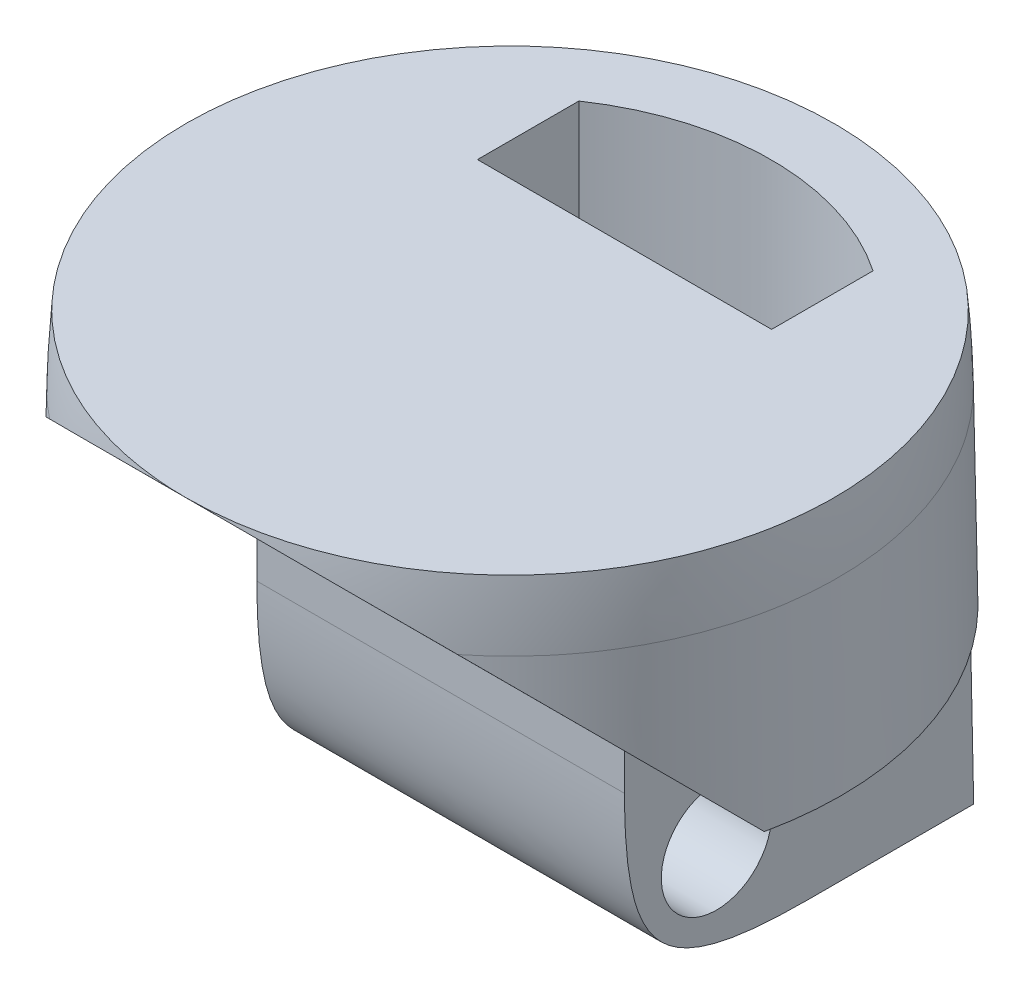
from build123d import *
from build123d.topology import SkipClean

# Parameters (mm, degrees)
SKETCH1_R                     = 9
BOSS_EXTRUDE1_DEPTH           = 15
BOSS_EXTRUDE1_TAPER           = 1
BOSS_EXTRUDE1_OTHER_WAY_DEPTH = 6
BOSS_EXTRUDE1_OTHER_WAY_TAPER = -1
CUT_EXTRUDE1_DEPTH            = 20.768465569
CUT_EXTRUDE1_DEPTH_BACK       = 20.768465569
SKETCH4_W                     = 6.502745185
SKETCH4_H                     = 6
CUT_EXTRUDE2_DEPTH            = 21.704916006
SKETCH5_R                     = 1.5
CUT_EXTRUDE3_DEPTH            = 23.447630679
FILLET1_SIZE                  = 5
CUT_EXTRUDE4_DEPTH            = 20.720449338
CUT_EXTRUDE4_DEPTH_BACK       = 20.720449338
SKETCH6_W                     = 20.06778765
SKETCH6_H                     = 8.725289236
CUT_EXTRUDE5_DEPTH            = 19.193852051


with BuildPart() as part:
    # Sketch1 → Boss-Extrude1 (new body)
    with BuildSketch(Plane(origin=(0, 0, 0), x_dir=(1, 0, 0), z_dir=(0, 1, 0))):
        Circle(SKETCH1_R)
    extrude(amount=BOSS_EXTRUDE1_DEPTH, taper=BOSS_EXTRUDE1_TAPER)

    # Sketch1 → Boss-Extrude1 other way (add)
    with BuildSketch(Plane(origin=(0, 0, 0), x_dir=(1, 0, 0), z_dir=(0, 1, 0))):
        Circle(SKETCH1_R)
    extrude(amount=-BOSS_EXTRUDE1_OTHER_WAY_DEPTH, taper=BOSS_EXTRUDE1_OTHER_WAY_TAPER)

    # Sketch3 → Cut-Extrude1 (cut, two sides: drawn at the far end of the back side and taken through both)
    with BuildSketch(Plane(origin=(0, 0, 0), x_dir=(0, 0, -1), z_dir=(1, 0, 0)).offset(-CUT_EXTRUDE1_DEPTH_BACK)):
        Polygon((-1.886057768, -6), (-1.886057768, 0), (-9.929766736, 8.043708969), (-9.929766736, -6), align=None)
    extrude(amount=CUT_EXTRUDE1_DEPTH + CUT_EXTRUDE1_DEPTH_BACK, mode=Mode.SUBTRACT)

    # Sketch4 → Cut-Extrude2 (cut, through all)
    with BuildSketch(Plane.XY.offset(1.886057768)):
        with Locations((-8.251372593, -3)):
            Rectangle(SKETCH4_W, SKETCH4_H)
        with Locations((8.251372593, -3)):
            Rectangle(SKETCH4_W, SKETCH4_H)
    extrude(amount=-CUT_EXTRUDE2_DEPTH, mode=Mode.SUBTRACT)

    # Sketch5 → Cut-Extrude3 (cut, through all)
    with BuildSketch(Plane(origin=(5, 0, 0), x_dir=(0, 0, -1), z_dir=(1, 0, 0))):
        with Locations((0.613942232, -3.5)):
            Circle(SKETCH5_R)
    extrude(amount=-CUT_EXTRUDE3_DEPTH, mode=Mode.SUBTRACT)

    # Fillet1
    # a fillet whose section is not a circle: 5 mm, written as the material it takes off along each edge
    with BuildSketch(Plane(origin=(17.5, -6, 1.886057768), x_dir=(0, 0, -1), z_dir=(-1, 0, 0))) as fillet1_piece_1:
        with BuildLine():
            Bezier((FILLET1_SIZE, 0), (0, 0), (0, -FILLET1_SIZE), weights=[1, 1.5, 1])
            Line((0, -FILLET1_SIZE), (0, 0))
            Line((0, 0), (FILLET1_SIZE, 0))
        make_face()
    extrude(amount=35, mode=Mode.SUBTRACT)

    # Fillet2
    # a fillet whose section is not a circle: 10, 5 mm, written as the material it takes off along each edge
    with BuildSketch(Plane(origin=(0, 15, 0), x_dir=(1, 0, 0), z_dir=(0, 0, -1))) as fillet2_piece_1:
        with BuildLine():
            Bezier((8.911201511, 9.912737968), (8.738174026, 0), (3.911963035, 0), weights=[1, 0.818181818, 1])
            Line((3.911963035, 0), (8.738174026, 0))
            Line((8.738174026, 0), (8.911201511, 9.912737968))
        make_face()
    revolve(axis=Axis((0, 15, 0), (0, -1, 0)), mode=Mode.SUBTRACT)

    # Sketch6 → Cut-Extrude4 (cut, two sides: drawn at the far end of the back side and taken through both)
    with SkipClean():  # the faces are left unmerged after this step: merging them gives an invalid solid
        with BuildSketch(Plane(origin=(0, 0, 0), x_dir=(0, 0, -1), z_dir=(1, 0, 0)).offset(-CUT_EXTRUDE4_DEPTH_BACK)):
            with Locations((1.220340909, 11.290139764)):
                Rectangle(SKETCH6_W, SKETCH6_H)
        extrude(amount=CUT_EXTRUDE4_DEPTH + CUT_EXTRUDE4_DEPTH_BACK, mode=Mode.SUBTRACT)
    add(part.part.scale(1), mode=Mode.REPLACE)  # the faces are merged on a copy

    # Sketch7 → Cut-Extrude5 (cut, through all)
    with BuildSketch(Plane.XZ.offset(6)):
        with BuildLine():
            Line((4, -3.113942232), (4, -5.871728358))
            ThreePointArc((4, -5.871728358), (0, -7.10473039), (-4, -5.871728358))
            Line((-4, -5.871728358), (-4, -3.113942232))
            Line((-4, -3.113942232), (4, -3.113942232))
        make_face()
    extrude(amount=-CUT_EXTRUDE5_DEPTH, mode=Mode.SUBTRACT)


solid = part.part
